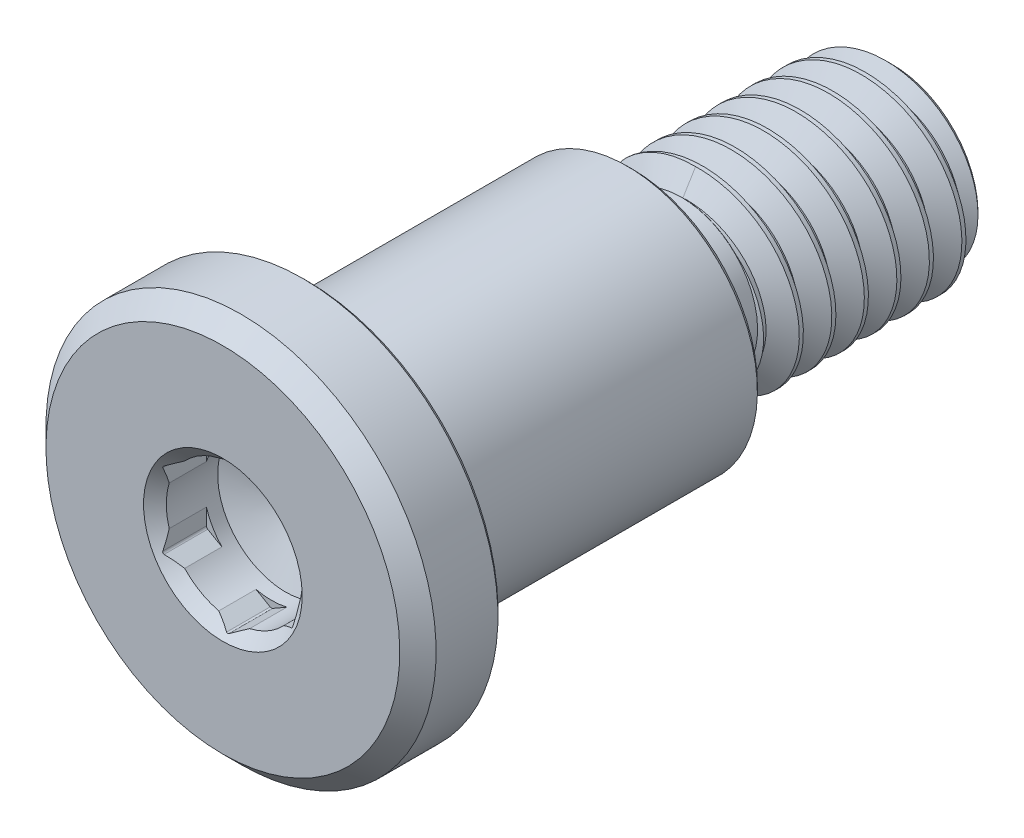
from build123d import *

# Parameters (mm, degrees)
CHAMFER1_SIZE       = 0.2795
CHAMFER4_SIZE       = 0.069875
CHAMFER2_SIZE       = 0.08
FILLET1_R           = 0.064
CHAMFER3_SIZE       = 0.1875
SKETCH11_R          = 1.045
CUT_EXTRUDE4_DEPTH  = 0.965
CUT_EXTRUDE1_DEPTH  = 0.74691
SKETCH6_R           = 1.22
CUT_EXTRUDE2_DEPTH  = 0.965
CUT_EXTRUDE2_DRAFT  = -45
FILLET2_R           = 0.04
FILLET3_R           = 0.24992
CUT_SWEEP1_PITCH    = 0.5
SKETCH10_R          = 1.175240474
BOSS_EXTRUDE1_DEPTH = 7.051467
BOSS_EXTRUDE1_TAPER = 60


with BuildPart() as part:
    # Sketch2 → Revolve1 (revolve)
    with BuildSketch(Plane(origin=(0, 0, 0), x_dir=(0, 0, -1), z_dir=(1, 0, 0))):
        Polygon((-1.3, 3), (0, 3), (0, 2), (5, 2), (5, 1.5), (9, 1.5), (9, 0), (-1.3, 0), align=None)
    revolve(axis=Axis((0, 0, 0), (0, 0, 1)))

    # Chamfer1
    chamfer1_edges = [part.edges().sort_by_distance(p)[0] for p in [
        (0, -3, 1.3),
    ]]
    chamfer(chamfer1_edges, length=CHAMFER1_SIZE)

    # Chamfer4
    chamfer4_edges = [part.edges().sort_by_distance(p)[0] for p in [
        (0, -3, 0),
    ]]
    chamfer(chamfer4_edges, length=CHAMFER4_SIZE)

    # Sketch3 → Cut-Revolve1 (revolve, cut)
    with BuildSketch(Plane(origin=(0, 0, 0), x_dir=(0, 0, -1), z_dir=(1, 0, 0))):
        with BuildLine():
            Line((0, 2), (0.424901587, 2))
            Line((0.424901587, 2), (0.300450793, 1.875549207))
            ThreePointArc((0.300450793, 1.875549207), (0.108647716, 1.837397202), (0, 2))
        make_face()
    revolve(axis=Axis((0, 0, -9), (0, 0, 1)), mode=Mode.SUBTRACT)

    # Sketch4 → Cut-Revolve2 (revolve, cut)
    with BuildSketch(Plane(origin=(0, 0, 0), x_dir=(0, 0, -1), z_dir=(1, 0, 0))):
        Polygon((5, 1.5), (5.93896647, 1.5), (5.75, 1.172700474), (5, 1.172700474), align=None)
    revolve(axis=Axis((0, 0, -9), (0, 0, 1)), mode=Mode.SUBTRACT)

    # Chamfer2
    chamfer2_edges = [part.edges().sort_by_distance(p)[0] for p in [
        (0, -2, -5),
    ]]
    chamfer(chamfer2_edges, length=CHAMFER2_SIZE)

    # Fillet1
    fillet1_edges = [part.edges().sort_by_distance(p)[0] for p in [
        (0, -1.172700474, -5),
    ]]
    fillet(fillet1_edges, radius=FILLET1_R)

    # Chamfer3
    chamfer3_edges = [part.edges().sort_by_distance(p)[0] for p in [
        (0, -1.5, -9),
    ]]
    chamfer(chamfer3_edges, length=CHAMFER3_SIZE)

    # Sketch11 → Cut-Extrude4 (cut)
    with BuildSketch(Plane.XY.offset(1.3)):
        Circle(SKETCH11_R)
    extrude(amount=-CUT_EXTRUDE4_DEPTH, mode=Mode.SUBTRACT)

    # Sketch5 → Cut-Extrude1 (cut)
    with BuildSketch(Plane.XY.offset(1.3)):
        Polygon((0, 1.154700538), (-1, 0.577350269), (-1, -0.577350269), (0, -1.154700538), (1, -0.577350269), (1, 0.577350269), align=None)
    extrude(amount=-CUT_EXTRUDE1_DEPTH, mode=Mode.SUBTRACT)


with BuildPart() as cut_extrude2_tool:
    # Sketch6 → Cut-Extrude2 (with draft: the straight prism first)
    with BuildSketch(Plane.XY.offset(1.3)):
        Circle(SKETCH6_R)
    extrude(amount=-CUT_EXTRUDE2_DEPTH)
    # Cut-Extrude2: the draft: its side faces are tilted about the plane it starts from
    cut_extrude2_sides = [cut_extrude2_tool.faces().sort_by_distance(p)[0] for p in [
        (-1.22, 0, 0.8175),
    ]]
    draft(cut_extrude2_sides, Plane.XY.offset(1.3), CUT_EXTRUDE2_DRAFT)


with BuildPart() as part_1:
    add(part.part)

    # Cut-Extrude2: cut by cut_extrude2_tool
    add(cut_extrude2_tool.part, mode=Mode.SUBTRACT)

    # Cut-Extrude3 cone 1 section (through the dimple's axis) → Cut-Extrude3 (revolve, cut)
    with BuildSketch(Plane(origin=(0, 0, 0.335), x_dir=(0, -1, 0), z_dir=(1, 0, 0))):
        Polygon((0, 0), (1.045, 0), (0, 0.380348895), align=None)
    revolve(axis=Axis((0, 0, 0.335), (0, 0, -1)), mode=Mode.SUBTRACT)

    # Fillet2
    fillet2_edges = [part_1.edges().sort_by_distance(p)[0] for p in [
        (1, 0.577350269, 0.893895269),
        (0, 1.154700538, 0.893895269),
        (-1, 0.577350269, 0.893895269),
        (0, -1.154700538, 0.893895269),
        (1, -0.577350269, 0.893895269),
        (-1, -0.577350269, 0.893895269),
    ]]
    fillet(fillet2_edges, radius=FILLET2_R)

    # Fillet3
    fillet3_edges = [part_1.edges().sort_by_distance(p)[0] for p in [
        (0, -2, -0.424901587),
    ]]
    fillet(fillet3_edges, radius=FILLET3_R)


with BuildPart() as body_2:
    # Split1: the piece on the far side of the plane
    add(part_1.part)
    split(bisect_by=Plane.XY.offset(-5.75), keep=Keep.BOTTOM)

    # Cut-Sweep1: the profile of Sketch7 screwed along a right-hand helix of 7.5 turns, 6 arcs to a turn; built about Z, then put on its axis
    cut_sweep1_z = Axis((0, 0, 0), (0, 0, 1))
    cut_sweep1_corners = [(1.175240474, 0, -0.1875), (1.175240474, 0, -0.25), (1.527063294, 0, -0.453125), (1.527063294, 0, 0.015625)]
    with BuildLine(mode=Mode.PRIVATE) as cut_sweep1_profile:
        Line(cut_sweep1_corners[0], cut_sweep1_corners[1])
        Line(cut_sweep1_corners[1], cut_sweep1_corners[2])
        Line(cut_sweep1_corners[2], cut_sweep1_corners[3])
        Line(cut_sweep1_corners[3], cut_sweep1_corners[0])
    cut_sweep1_cap = Face(cut_sweep1_profile.wire())
    cut_sweep1_turn_angles = [0, 30, 60, 90, 120, 150, 180, 210, 240, 270, 300, 330, 360]
    cut_sweep1_turn_weights = [1, 0.8660254037844387, 1, 0.8660254037844387, 1, 0.8660254037844387, 1, 0.8660254037844387, 1, 0.8660254037844387, 1, 0.8660254037844387, 1]
    cut_sweep1_turn_rails = [Edge.make_bspline([Vector(p[0], p[1], 0).rotate(cut_sweep1_z, cut_sweep1_turn_angles[k]) / cut_sweep1_turn_weights[k] + Vector(0, 0, p[2] + CUT_SWEEP1_PITCH * cut_sweep1_turn_angles[k] / 360) for k in range(13)], [0, 0, 0, 1, 1, 2, 2, 3, 3, 4, 4, 5, 5, 6, 6, 6], 2, cut_sweep1_turn_weights) for p in cut_sweep1_corners]
    cut_sweep1_turn_sides = [Face.make_surface_from_curves(cut_sweep1_turn_rails[p[0]], cut_sweep1_turn_rails[p[1]]) for p in [(0, 1), (1, 2), (2, 3), (3, 0)]]
    cut_sweep1_last_angles = [2520, 2550, 2580, 2610, 2640, 2670, 2700]
    cut_sweep1_last_weights = [1, 0.8660254037844387, 1, 0.8660254037844387, 1, 0.8660254037844446, 1]
    cut_sweep1_last_rails = [Edge.make_bspline([Vector(p[0], p[1], 0).rotate(cut_sweep1_z, cut_sweep1_last_angles[k]) / cut_sweep1_last_weights[k] + Vector(0, 0, p[2] + CUT_SWEEP1_PITCH * cut_sweep1_last_angles[k] / 360) for k in range(7)], [0, 0, 0, 1, 1, 2, 2, 3, 3, 3], 2, cut_sweep1_last_weights) for p in cut_sweep1_corners]
    cut_sweep1_last_sides = [Face.make_surface_from_curves(cut_sweep1_last_rails[p[0]], cut_sweep1_last_rails[p[1]]) for p in [(0, 1), (1, 2), (2, 3), (3, 0)]]
    cut_sweep1 = Plane(origin=(0, 0, -9), x_dir=(0, 1, 0), z_dir=(0, 0, 1)) * Solid(Shell([*[p.moved(Location((0, 0, CUT_SWEEP1_PITCH * i))) for i in range(7) for p in cut_sweep1_turn_sides], *cut_sweep1_last_sides, cut_sweep1_cap, cut_sweep1_cap.rotate(cut_sweep1_z, 2700).moved(Location((0, 0, CUT_SWEEP1_PITCH * 2700 / 360)))]))
    add(cut_sweep1, mode=Mode.SUBTRACT)


with BuildPart() as part_2:
    add(part_1.part)

    # Split1
    split(bisect_by=Plane.XY.offset(-5.75), keep=Keep.TOP)

    add(body_2.part)  # Boss-Extrude1 merges body 2
    # Sketch10 → Boss-Extrude1 (add, through all)
    with BuildSketch(Plane.XY.offset(-5.75146647)):
        Circle(SKETCH10_R)
    extrude(amount=BOSS_EXTRUDE1_DEPTH, taper=BOSS_EXTRUDE1_TAPER)


solid = part_2.part
